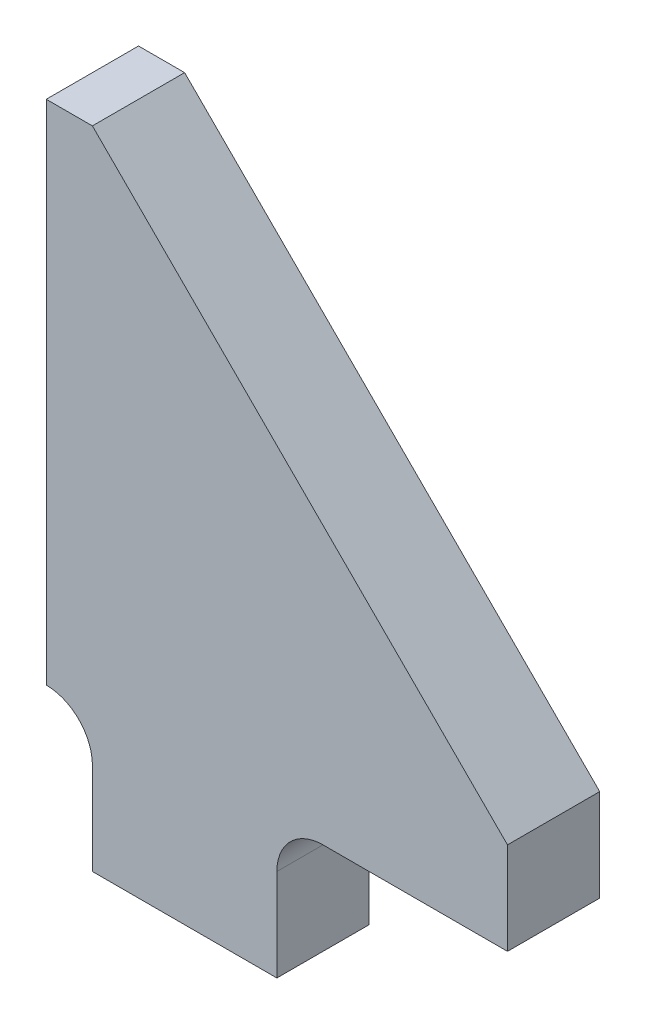
from build123d import *

# Parameters (mm, degrees)
BOSS_EXTRU_1_DEPTH = 2
CONG_1_R           = 1


with BuildPart() as part:
    # Esquisse1 → Boss.-Extru.1 (new body)
    with BuildSketch(Plane.XY):
        Polygon((0, 0), (0, 11), (1, 11), (10, 2), (10, 0), (5, 0), (5, -3), (1, -3), (1, 0), align=None)
    extrude(amount=BOSS_EXTRU_1_DEPTH)

    # Congé1
    cong_1_edges = [part.edges().sort_by_distance(p)[0] for p in [
        (5, 0, 1),
        (1, 0, 1),
    ]]
    fillet(cong_1_edges, radius=CONG_1_R - 0.0001)  # a hair under: the kernel refuses the full size


solid = part.part
